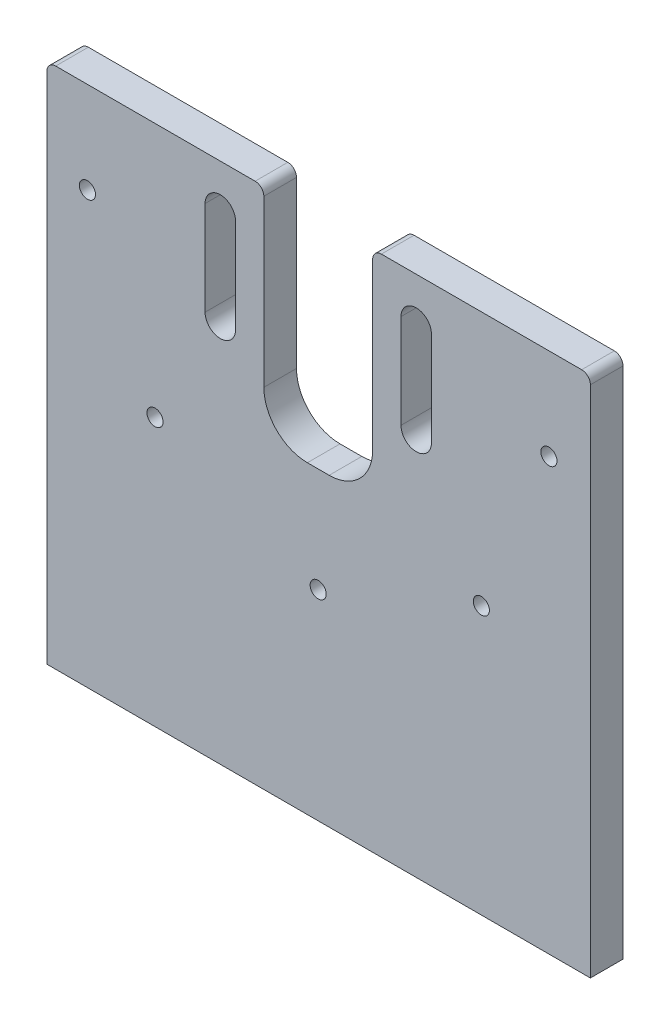
from build123d import *

# Parameters (mm, degrees)
SKETCH2_R           = 1.85
BOSS_EXTRUDE7_DEPTH = 7.5


with BuildPart() as part:
    # Sketch2 → Boss-Extrude7 (new body)
    with BuildSketch(Plane.XY):
        with BuildLine():
            Line((0, 0), (0, 118))
            ThreePointArc((0, 118), (0.585786438, 119.414213562), (2, 120))
            Line((2, 120), (47.812758192, 120))
            ThreePointArc((47.812758192, 120), (49.226971755, 119.414213562), (49.812758192, 118))
            Line((49.812758192, 118), (49.812758192, 80))
            ThreePointArc((49.812758192, 80), (52.74169038, 72.928932188), (59.812758192, 70))
            Line((59.812758192, 70), (64.812758192, 70))
            ThreePointArc((64.812758192, 70), (71.883826004, 72.928932188), (74.812758192, 80))
            Line((74.812758192, 80), (74.812758192, 118))
            ThreePointArc((74.812758192, 118), (75.39854463, 119.414213562), (76.812758192, 120))
            Line((76.812758192, 120), (122.812758192, 120))
            ThreePointArc((122.812758192, 120), (124.226971755, 119.414213562), (124.812758192, 118))
            Line((124.812758192, 118), (124.812758192, 0))
            Line((124.812758192, 0), (0, 0))
        make_face()
        with Locations((115.293642293, 99)):
            Circle(SKETCH2_R, mode=Mode.SUBTRACT)
        with Locations((99.770301696, 61.523340597)):
            Circle(SKETCH2_R, mode=Mode.SUBTRACT)
        with Locations((62.293642293, 46)):
            Circle(SKETCH2_R, mode=Mode.SUBTRACT)
        with Locations((24.81698289, 61.523340597)):
            Circle(SKETCH2_R, mode=Mode.SUBTRACT)
        with Locations((9.293642293, 99)):
            Circle(SKETCH2_R, mode=Mode.SUBTRACT)
        with BuildLine():
            Line((36.312758192, 88.190430343), (36.312758192, 109.809569657))
            ThreePointArc((36.312758192, 109.809569657), (39.812758192, 113.309569657), (43.312758192, 109.809569657))
            Line((43.312758192, 109.809569657), (43.312758192, 88.190430343))
            ThreePointArc((43.312758192, 88.190430343), (39.812758192, 84.690430343), (36.312758192, 88.190430343))
        make_face(mode=Mode.SUBTRACT)
        with BuildLine():
            Line((88.312758192, 88.190430343), (88.312758192, 109.809569657))
            ThreePointArc((88.312758192, 109.809569657), (84.812758192, 113.309569657), (81.312758192, 109.809569657))
            Line((81.312758192, 109.809569657), (81.312758192, 88.190430343))
            ThreePointArc((81.312758192, 88.190430343), (84.812758192, 84.690430343), (88.312758192, 88.190430343))
        make_face(mode=Mode.SUBTRACT)
    extrude(amount=BOSS_EXTRUDE7_DEPTH)


solid = part.part
